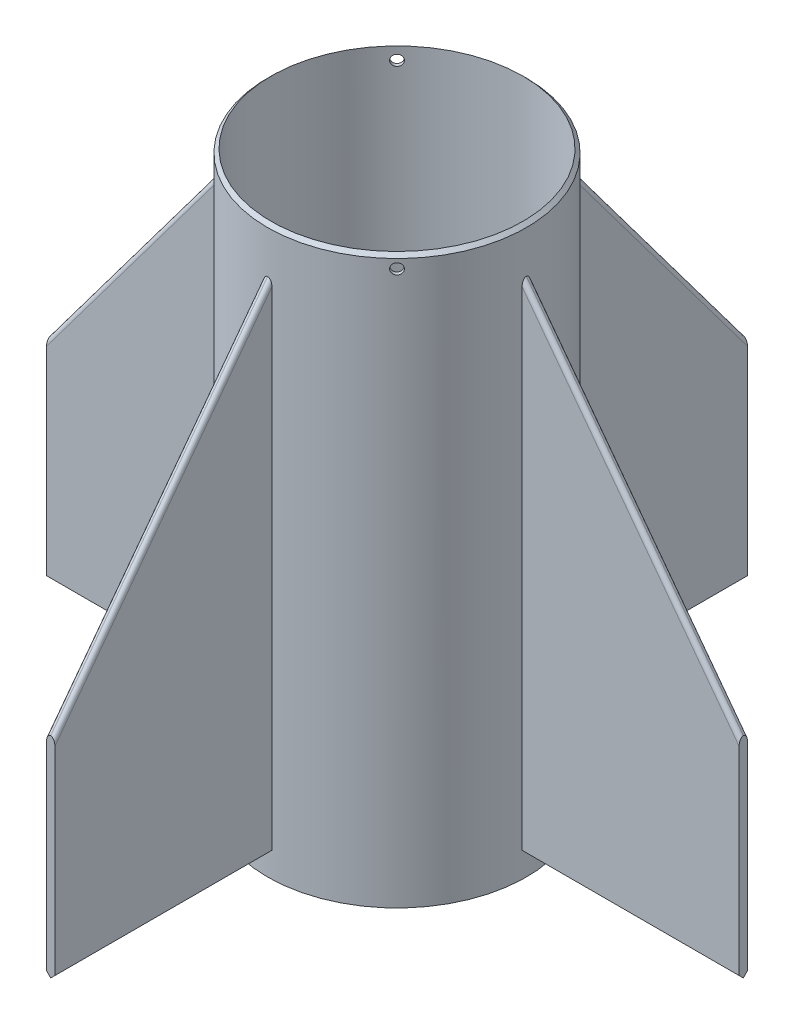
from build123d import *

# Parameters (mm, degrees)
SKETCH1_R                = 78.359
SKETCH1_R_2              = 76.2
BOSS_EXTRUDE1_DEPTH      = 342.9
BOSS_EXTRUDE2_DEPTH      = 2.54
BOSS_EXTRUDE2_DEPTH_BACK = 2.54
FILLET2_R                = 2.54
CHAMFER2_SIZE            = 2.54
CIRPATTERN1_COUNT        = 4
SKETCH4_R                = 3.175
CUT_EXTRUDE1_DEPTH       = 454.213873353
CIRPATTERN2_COUNT        = 4
CHAMFER3_SIZE            = 2.54


# Some blends are built 0.0001 mm under size
with BuildPart() as part:
    # Sketch1 → Boss-Extrude1 (new body)
    with BuildSketch(Plane(origin=(0, 0, 0), x_dir=(1, 0, 0), z_dir=(0, 1, 0))):
        with Locations(Location((0, 0, 0), (0, 0, 270))):
            Circle(SKETCH1_R)
        with Locations(Location((0, 0, 0), (0, 0, 270))):
            Circle(SKETCH1_R_2, mode=Mode.SUBTRACT)
    extrude(amount=BOSS_EXTRUDE1_DEPTH)

    # Sketch4 → Cut-Extrude1 (cut, through all)
    with BuildSketch(Plane(origin=(0, 0, 0), x_dir=(-0.7071067811865462, 0, 0.7071067811865489), z_dir=(-0.7071067811865489, 0, -0.7071067811865462))):
        with Locations((0, 334.9498)):
            Circle(SKETCH4_R)
    cut_extrude1 = extrude(amount=-CUT_EXTRUDE1_DEPTH, mode=Mode.SUBTRACT)

    # CirPattern2: Cut-Extrude1 ×4 about axis
    cirpattern2_axis = Axis((0, -69.284011973, 0), (0, 1, 0))
    for i in range(1, CIRPATTERN2_COUNT):
        add(cut_extrude1.rotate(cirpattern2_axis, i * 360 / CIRPATTERN2_COUNT), mode=Mode.SUBTRACT)

    # Chamfer3
    # the kernel refuses this chamfer: 2.54 mm, written as the material it takes off along each edge
    with BuildSketch(Plane(origin=(0, 342.9, 0), x_dir=(0, 0, 1), z_dir=(-1, 0, 0))) as chamfer3_piece_1:
        Polygon((78.359, -CHAMFER3_SIZE), (78.359 - CHAMFER3_SIZE, 0), (78.359, 0), align=None)
    revolve(axis=Axis((0, 342.9, 0), (0, 1, 0)), mode=Mode.SUBTRACT)


with BuildPart() as body_2:
    # Sketch2 → Boss-Extrude2 (new, two sides: drawn at the far end of the back side and taken through both)
    with BuildSketch(Plane.XY.offset(-BOSS_EXTRUDE2_DEPTH_BACK)):
        Polygon((76.2, 317.5), (76.2, 12.7), (209.55, 12.7), (209.55, 139.7), align=None)
    extrude(amount=BOSS_EXTRUDE2_DEPTH + BOSS_EXTRUDE2_DEPTH_BACK)

    # Fillet2
    fillet2_edges = [body_2.edges().sort_by_distance(p)[0] for p in [
        (142.875, 228.6, -2.54),
        (142.875, 228.6, 2.54),
    ]]
    fillet(fillet2_edges, radius=FILLET2_R - 0.0001)  # a hair under: the kernel refuses the full size

    # Chamfer2
    chamfer2_edges = [body_2.edges().sort_by_distance(p)[0] for p in [
        (142.875, 12.7, -2.54),
        (142.875, 12.7, 2.54),
    ]]
    chamfer(chamfer2_edges, length=CHAMFER2_SIZE - 0.0001)  # a hair under: the kernel refuses the full size


with BuildPart() as cirpattern1_1:
    # CirPattern1: pattern copy
    add(body_2.part.rotate(Axis((0, 0, 0), (0, 1, 0)), 1 * 360 / CIRPATTERN1_COUNT))


with BuildPart() as cirpattern1_2:
    # CirPattern1: pattern copy
    add(body_2.part.rotate(Axis((0, 0, 0), (0, 1, 0)), 2 * 360 / CIRPATTERN1_COUNT))


with BuildPart() as cirpattern1_3:
    # CirPattern1: pattern copy
    add(body_2.part.rotate(Axis((0, 0, 0), (0, 1, 0)), 3 * 360 / CIRPATTERN1_COUNT))


solid = Compound([part.part, body_2.part, cirpattern1_1.part, cirpattern1_2.part, cirpattern1_3.part])
